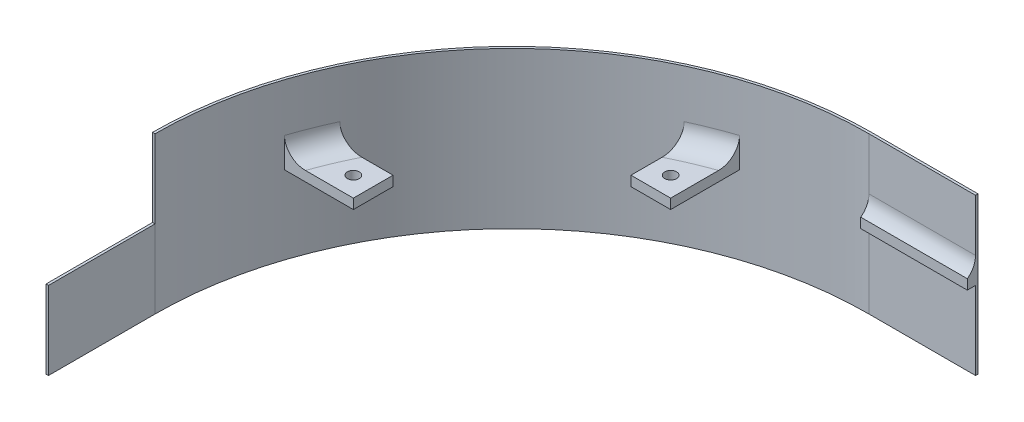
from build123d import *
from build123d.topology import SkipClean

# Parameters (mm, degrees)
BOSS_EXTRUDE1_DEPTH      = 6.35
CUT_EXTRUDE1_DEPTH       = 6.35
M4_CLEARANCE_HOLE1_D     = 4.5
F_6_CLEARANCE_HOLE1_D    = 3.7973
F_6_CLEARANCE_HOLE2_D    = 3.7973
SKETCH29_R               = 1.898650000000008
BOSS_EXTRUDE4_DEPTH      = 3.175
CUT_EXTRUDE9_DEPTH       = 211.00951038732748
BOSS_EXTRUDE5_DEPTH      = 25
BOSS_EXTRUDE5_DEPTH_BACK = 25
BOSS_EXTRUDE6_DEPTH      = 3.420518063
SKETCH32_W               = 34.13124999999999
SKETCH32_H               = 3.175
BOSS_EXTRUDE7_DEPTH      = 3.420518063
FILLET2_R                = 6.35
FILLET3_R                = 6.35
SKETCH33_W               = 62.65129797244943
SKETCH33_H               = 51.38023684891144
CUT_EXTRUDE10_DEPTH      = 211.97362412866636


with BuildPart() as part:
    # Sketch1 → Boss-Extrude1 (new body)
    with BuildSketch(Plane(origin=(0, 0, 0), x_dir=(1, 0, 0), z_dir=(0, 1, 0))):
        with BuildLine():
            Line((-34.13124999999996, -148.43124999999998), (34.131250000000016, -148.43124999999998))
            ThreePointArc((34.131250000000016, -148.43124999999998), (114.9535550896224, -114.95355508962234), (148.43124999999998, -34.13124999999996))
            Line((148.43124999999998, -34.13124999999996), (148.43124999999998, 34.131250000000016))
            ThreePointArc((148.43124999999998, 34.131250000000016), (114.9535550896224, 114.9535550896224), (34.131250000000016, 148.43125000000003))
            Line((34.131250000000016, 148.43125000000003), (-34.13124999999996, 148.43125000000003))
            ThreePointArc((-34.13124999999996, 148.43125000000003), (-114.95355508962231, 114.95355508962237), (-148.43124999999992, 34.131250000000016))
            Line((-148.43124999999992, 34.131250000000016), (-148.43124999999992, -34.13124999999996))
            ThreePointArc((-148.43124999999992, -34.13124999999996), (-114.95355508962234, -114.95355508962234), (-34.13124999999996, -148.43124999999998))
        make_face()
    extrude(amount=BOSS_EXTRUDE1_DEPTH)

    # Sketch4 → Cut-Extrude1 (cut)
    # profile 1 of 4: a face of its own
    with BuildSketch(Plane(origin=(0, 6.35, 0), x_dir=(1, 0, 0), z_dir=(0, 1, 0))):
        with BuildLine():
            ThreePointArc((-39.4480000000008, 145.80448193711538), (-49.893930566331434, 144.3300216659586), (-59.52363351317686, 140.0218527227403))
            ThreePointArc((-59.52363351317686, 140.0218527227403), (-63.81750000000949, 132.2535819370977), (-59.52363351317676, 124.48531115145514))
            ThreePointArc((-59.52363351317676, 124.48531115145514), (-49.89393056632884, 120.17714220824536), (-39.448000000000604, 118.70268193708908))
            Line((-39.448000000000604, 118.70268193708908), (39.44799999999939, 118.70268193708088))
            ThreePointArc((39.44799999999939, 118.70268193708088), (49.89393056633003, 120.17714220823765), (59.52363351317546, 124.48531115145597))
            ThreePointArc((59.52363351317546, 124.48531115145597), (63.817500000008096, 132.25358193709857), (59.523633513170694, 140.0218527227337))
            ThreePointArc((59.523633513170694, 140.0218527227337), (49.893930566325004, 144.3300216659425), (39.4479999999992, 145.80448193710717))
            Line((39.4479999999992, 145.80448193710717), (-39.4480000000008, 145.80448193711538))
        make_face()
        with BuildLine():
            ThreePointArc((39.447999999999375, 120.29018193708089), (49.454528647108134, 121.70261990502122), (58.67916380898574, 125.82956825808905))
            ThreePointArc((58.67916380898574, 125.82956825808905), (62.229999999999336, 132.25358193709857), (58.67916380898565, 138.67759561610805))
            ThreePointArc((58.67916380898565, 138.67759561610805), (49.45452864710313, 142.80454396915894), (39.447999999999205, 144.21698193711595))
            Line((39.447999999999205, 144.21698193711595), (-39.44800000000079, 144.21698193711538))
            ThreePointArc((-39.44800000000079, 144.21698193711538), (-49.454528647109534, 142.80454396917506), (-58.67916380898715, 138.67759561610723))
            ThreePointArc((-58.67916380898715, 138.67759561610723), (-62.23000000000073, 132.25358193709772), (-58.67916380898706, 125.82956825808822))
            ThreePointArc((-58.67916380898706, 125.82956825808822), (-49.454528647104546, 121.70261990503734), (-39.44800000000062, 120.29018193708033))
            Line((-39.44800000000062, 120.29018193708033), (39.447999999999375, 120.29018193708089))
        make_face(mode=Mode.SUBTRACT)
    # profile 2 of 4: a face of its own
    with BuildSketch(Plane(origin=(0, 6.35, 0), x_dir=(1, 0, 0), z_dir=(0, 1, 0))):
        with BuildLine():
            Line((-39.44800000000062, 120.29018193708033), (39.447999999999375, 120.29018193708089))
            ThreePointArc((39.447999999999375, 120.29018193708089), (49.454528647108134, 121.70261990502122), (58.67916380898574, 125.82956825808905))
            ThreePointArc((58.67916380898574, 125.82956825808905), (62.229999999999336, 132.25358193709857), (58.67916380898565, 138.67759561610805))
            ThreePointArc((58.67916380898565, 138.67759561610805), (49.45452864710313, 142.80454396915894), (39.447999999999205, 144.21698193711595))
            Line((39.447999999999205, 144.21698193711595), (-39.44800000000079, 144.21698193711538))
            ThreePointArc((-39.44800000000079, 144.21698193711538), (-49.454528647109534, 142.80454396917506), (-58.67916380898715, 138.67759561610723))
            ThreePointArc((-58.67916380898715, 138.67759561610723), (-62.23000000000073, 132.25358193709772), (-58.67916380898706, 125.82956825808822))
            ThreePointArc((-58.67916380898706, 125.82956825808822), (-49.454528647104546, 121.70261990503734), (-39.44800000000062, 120.29018193708033))
        make_face()
    # profile 3 of 4: a face of its own
    with BuildSketch(Plane(origin=(0, 6.35, 0), x_dir=(1, 0, 0), z_dir=(0, 1, 0))):
        with BuildLine():
            ThreePointArc((-59.5236335131764, -124.48531115145636), (-63.8175000000091, -132.25358193709894), (-59.52363351317174, -140.02185272273414))
            ThreePointArc((-59.52363351317174, -140.02185272273414), (-49.893930566326084, -144.33002166594298), (-39.44800000000029, -145.80448193711646))
            Line((-39.44800000000029, -145.80448193711646), (39.44799999999971, -145.80448193711646))
            ThreePointArc((39.44799999999971, -145.80448193711646), (49.89393056633035, -144.33002166595978), (59.52363351317579, -140.02185272274153))
            ThreePointArc((59.52363351317579, -140.02185272274153), (63.8175000000085, -132.25358193709894), (59.52363351317116, -124.48531115146376))
            ThreePointArc((59.52363351317116, -124.48531115146376), (49.89393056632551, -120.1771422082549), (39.44799999999971, -118.70268193709018))
            Line((39.44799999999971, -118.70268193709018), (-39.44800000000029, -118.70268193708142))
            ThreePointArc((-39.44800000000029, -118.70268193708142), (-49.89393056633094, -120.17714220823811), (-59.5236335131764, -124.48531115145636))
        make_face()
        with BuildLine():
            ThreePointArc((-58.679163808986694, -138.67759561610845), (-49.454528647104205, -142.8045439691594), (-39.44800000000029, -144.21698193711646))
            Line((-39.44800000000029, -144.21698193711646), (39.44799999999971, -144.21698193711646))
            ThreePointArc((39.44799999999971, -144.21698193711646), (49.45452864710846, -142.8045439691762), (58.679163808986104, -138.67759561610845))
            ThreePointArc((58.679163808986104, -138.67759561610845), (62.22999999999976, -132.25358193709894), (58.679163808986104, -125.82956825808944))
            ThreePointArc((58.679163808986104, -125.82956825808944), (49.45452864710362, -121.7026199050385), (39.44799999999971, -120.29018193708143))
            Line((39.44799999999971, -120.29018193708143), (-39.44800000000029, -120.29018193708143))
            ThreePointArc((-39.44800000000029, -120.29018193708143), (-49.45452864710904, -121.70261990502169), (-58.679163808986694, -125.82956825808944))
            ThreePointArc((-58.679163808986694, -125.82956825808944), (-62.230000000000345, -132.25358193709894), (-58.679163808986694, -138.67759561610845))
        make_face(mode=Mode.SUBTRACT)
    # profile 4 of 4: a face of its own
    with BuildSketch(Plane(origin=(0, 6.35, 0), x_dir=(1, 0, 0), z_dir=(0, 1, 0))):
        with BuildLine():
            ThreePointArc((-58.679163808986694, -125.82956825808944), (-62.230000000000345, -132.25358193709894), (-58.679163808986694, -138.67759561610845))
            ThreePointArc((-58.679163808986694, -138.67759561610845), (-49.454528647104205, -142.8045439691594), (-39.44800000000029, -144.21698193711646))
            Line((-39.44800000000029, -144.21698193711646), (39.44799999999971, -144.21698193711646))
            ThreePointArc((39.44799999999971, -144.21698193711646), (49.45452864710846, -142.8045439691762), (58.679163808986104, -138.67759561610845))
            ThreePointArc((58.679163808986104, -138.67759561610845), (62.22999999999976, -132.25358193709894), (58.679163808986104, -125.82956825808944))
            ThreePointArc((58.679163808986104, -125.82956825808944), (49.45452864710362, -121.7026199050385), (39.44799999999971, -120.29018193708143))
            Line((39.44799999999971, -120.29018193708143), (-39.44800000000029, -120.29018193708143))
            ThreePointArc((-39.44800000000029, -120.29018193708143), (-49.45452864710904, -121.70261990502169), (-58.679163808986694, -125.82956825808944))
        make_face()
    extrude(amount=-CUT_EXTRUDE1_DEPTH, mode=Mode.SUBTRACT)

    # M4 Clearance Hole1 (through all)
    with Locations(Plane(origin=(0, 6.35, 0), x_dir=(1, 0, 0), z_dir=(0, 1, 0))):
        with Locations((-16, -103.6875), (16, -103.6875), (22, -60.325), (-10, -60.325), (-10, 60.325), (22, 60.325), (16, 103.6875), (-16, 103.6875)):
            Hole(M4_CLEARANCE_HOLE1_D / 2)

    # #6 Clearance Hole1 (through all)
    with Locations(Plane(origin=(0, 6.35, 0), x_dir=(1, 0, 0), z_dir=(0, 1, 0))):
        with Locations((-101.6, -101.6), (-101.6, 101.6), (101.6, 101.6), (101.6, -101.6), (-127, -76.2), (-127, -50.8), (-127, 50.8), (-127, 76.2), (-101.6, 76.2), (-101.6, 50.8), (-101.6, 25.4), (-101.6, 0), (-101.6, -25.4), (-101.6, -50.8), (-101.6, -76.2), (-76.2, -101.6), (-50.8, -101.6), (-50.8, -76.2), (-76.2, -76.2), (-76.2, -50.8), (-50.8, -50.8), (-50.8, -25.4), (-76.2, -25.4), (-76.2, 0), (-50.8, 0), (-50.8, 25.4), (-76.2, 25.4), (-76.2, 50.8), (-50.8, 50.8), (-50.8, 76.2), (-76.2, 76.2), (-76.2, 101.6), (-50.8, 101.6), (50.8, -101.6), (76.2, -101.6), (101.6, -76.2), (127, -76.2), (127, -50.8), (101.6, -25.4), (101.6, -50.8), (76.2, -25.4), (76.2, -50.8), (76.2, -76.2), (50.8, -76.2), (50.8, -50.8), (50.8, -25.4), (50.8, 0), (76.2, 0), (101.6, 0), (101.6, 25.4), (101.6, 50.8), (101.6, 76.2), (127, 50.8), (127, 76.2), (76.2, 101.6), (50.8, 101.6), (50.8, 76.2), (76.2, 76.2), (76.2, 50.8), (76.2, 25.4), (50.8, 25.4), (50.8, 50.8), (0, 0), (-25.4, -25.4), (-25.4, 0), (-25.4, 25.4), (0, 25.4), (25.4, 25.4), (25.4, 0), (25.4, -25.4), (0, -25.4), (127, -25.4), (127, 0), (127, 25.4), (-127, -25.4), (-127, 0), (-127, 25.4)):
            Hole(F_6_CLEARANCE_HOLE1_D / 2)

    # #6 Clearance Hole2 (through all)
    with Locations(Plane(origin=(0, 6.35, 0), x_dir=(1, 0, 0), z_dir=(0, 1, 0))):
        with Locations((-76.2, -127), (76.2, -127), (76.2, 127), (-76.2, 127)):
            Hole(F_6_CLEARANCE_HOLE2_D / 2)

    # Sketch29 → Boss-Extrude4 (add)
    # profile 1 of 4: a face of its own
    with BuildSketch(Plane(origin=(0, 6.35, 0), x_dir=(1, 0, 0), z_dir=(0, 1, 0))):
        with BuildLine():
            Line((-69.85, 120.64999999999999), (-69.85, 142.70684992207043))
            ThreePointArc((-69.85, 142.70684992207043), (-76.27533753088031, 140.3779717667891), (-82.55, 137.66923649982286))
            Line((-82.55, 137.6692364998229), (-82.54999999999998, 120.64999999999999))
            Line((-82.54999999999998, 120.64999999999999), (-69.85, 120.64999999999999))
        make_face()
        with Locations(Location((-76.19999999999999, 127, 0), (0, 0, 270))):
            Circle(SKETCH29_R, mode=Mode.SUBTRACT)
    # profile 2 of 4: a face of its own
    with BuildSketch(Plane(origin=(0, 6.35, 0), x_dir=(1, 0, 0), z_dir=(0, 1, 0))):
        with BuildLine():
            Line((-120.6500000000006, 82.54999999999993), (-137.6692364998229, 82.54999999999993))
            ThreePointArc((-137.66923649982286, 82.5499999999999), (-140.37797176678907, 76.27533753088025), (-142.70684992207038, 69.84999999999994))
            Line((-142.70684992207043, 69.84999999999994), (-120.6500000000006, 69.84999999999994))
            Line((-120.6500000000006, 69.84999999999994), (-120.6500000000006, 82.54999999999993))
        make_face()
        with Locations(Location((-127.00000000000061, 76.19999999999993, 0), (0, 0, 270))):
            Circle(SKETCH29_R, mode=Mode.SUBTRACT)
    # profile 3 of 4: a face of its own
    with BuildSketch(Plane(origin=(0, 6.35, 0), x_dir=(1, 0, 0), z_dir=(0, 1, 0))):
        Polygon((-145.8044819371153, 34.13124999999998), (-145.8044819371153, 0), (-148.43124999999995, 2.082e-14), (-148.43124999999995, 34.131249999999994), align=None)
    # profile 4 of 4: a face of its own
    with BuildSketch(Plane(origin=(0, 6.35, 0), x_dir=(1, 0, 0), z_dir=(0, 1, 0))):
        Polygon((2.776e-14, 148.43125), (0, 145.80448193711538), (-34.13124999999999, 145.80448193711538), (-34.13124999999996, 148.43125000000003), align=None)
    extrude(amount=BOSS_EXTRUDE4_DEPTH)

    # Sketch30 → Cut-Extrude9 (cut, through all)
    with BuildSketch(Plane(origin=(0, 6.35, 0), x_dir=(1, 0, 0), z_dir=(0, 1, 0))):
        with BuildLine():
            Line((-34.13124999999998, -148.43124999999995), (34.131250000000016, -148.43124999999998))
            ThreePointArc((34.131250000000016, -148.43124999999998), (114.9535550896224, -114.95355508962234), (148.43125, -34.13124999999996))
            Line((148.43125, -34.13124999999996), (148.43124999999998, 34.131250000000016))
            ThreePointArc((148.43124999999998, 34.131250000000016), (114.95355508962237, 114.95355508962237), (34.13125000000002, 148.43125))
            Line((34.13125000000002, 148.43125), (-34.13124999999996, 148.43125000000003))
            ThreePointArc((-34.13124999999996, 148.43125000000003), (-114.95355508962234, 114.9535550896224), (-148.43124999999995, 34.13125000000003))
            Line((-148.43124999999995, 34.13125000000003), (-148.43124999999995, -34.131249999999945))
            ThreePointArc((-148.43124999999995, -34.131249999999945), (-114.95355508962234, -114.95355508962231), (-34.13124999999998, -148.43124999999995))
        make_face()
    extrude(amount=-CUT_EXTRUDE9_DEPTH, mode=Mode.SUBTRACT)


with BuildPart() as cut_extrude9_piece_1:
    # of the separate pieces the step leaves, piece 1, a body of its own (cut_extrude9_pieces)
    add(part.part.solids().sort_by_distance((-82.55, 6.35, -137.6692365))[0])



with BuildPart() as cut_extrude9_piece_2:
    # of the separate pieces the step leaves, piece 2, a body of its own (cut_extrude9_pieces)
    add(part.part.solids().sort_by_distance((-142.706849922, 6.35, -69.85))[0])


with BuildPart() as cut_extrude9_piece_3:
    # of the separate pieces the step leaves, piece 3, a body of its own (cut_extrude9_pieces)
    add(part.part.solids().sort_by_distance((-148.43125, 6.35, -34.13125))[0])


with BuildPart() as cut_extrude9_piece_4:
    # of the separate pieces the step leaves, piece 4, a body of its own (cut_extrude9_pieces)
    add(part.part.solids().sort_by_distance((-34.13125, 6.35, -145.804481937))[0])


with BuildPart() as cut_extrude9_piece_1_1:
    add(cut_extrude9_piece_1.part)

    add(cut_extrude9_piece_2.part)  # Boss-Extrude5 merges Cut-Extrude9 piece 2
    # Sketch29<7> → Boss-Extrude5 (add, two sides: drawn at the far end of the back side and taken through both)
    with BuildSketch(Plane(origin=(0, 6.35, 0), x_dir=(1, 0, 0), z_dir=(0, 1, 0)).offset(-BOSS_EXTRUDE5_DEPTH_BACK)):
        with BuildLine():
            ThreePointArc((-69.85, 142.70684992207043), (-52.21852354947877, 146.99107693388436), (-34.13124999999996, 148.43125000000003))
            Line((-34.13124999999996, 148.43125000000003), (2.842e-14, 148.43125))
            Line((2.776e-14, 148.43125), (2.776e-14, 149.22500000000002))
            Line((2.776e-14, 149.22500000000002), (-34.13124999999996, 149.22500000000002))
            ThreePointArc((-34.13124999999995, 149.22500000000002), (-115.51482109718914, 115.51482109718923), (-149.22499999999997, 34.13125000000003))
            Line((-149.22499999999997, 34.131249999999994), (-149.22499999999997, 2.132e-14))
            Line((-149.22499999999997, 2.082e-14), (-148.43124999999995, 2.082e-14))
            Line((-148.43124999999995, 2.132e-14), (-148.43124999999995, 34.131249999999994))
            ThreePointArc((-148.43124999999995, 34.13125000000001), (-146.9910769338843, 52.218523549478746), (-142.70684992207038, 69.84999999999994))
            ThreePointArc((-142.70684992207038, 69.84999999999994), (-140.37797176678907, 76.27533753088025), (-137.66923649982286, 82.5499999999999))
            ThreePointArc((-137.6692364998229, 82.54999999999994), (-114.9535550896224, 114.95355508962237), (-82.55000000000001, 137.66923649982292))
            ThreePointArc((-82.55, 137.66923649982286), (-76.27533753088031, 140.3779717667891), (-69.85, 142.70684992207043))
        make_face()
    extrude(amount=BOSS_EXTRUDE5_DEPTH + BOSS_EXTRUDE5_DEPTH_BACK)


    add(cut_extrude9_piece_3.part)  # Boss-Extrude6 merges Cut-Extrude9 piece 3
    # Sketch31 → Boss-Extrude6 (add)
    with BuildSketch(Plane(origin=(-145.8044819371153, 0, 0), x_dir=(0, 0, -1), z_dir=(1, 0, 0))):
        Polygon((1.15561e-12, 6.35), (34.13124999999998, 6.35), (34.13124999999998, 9.524999999999999), (1.15548e-12, 9.524999999999999), align=None)
    extrude(amount=-BOSS_EXTRUDE6_DEPTH)


    add(cut_extrude9_piece_4.part)  # Boss-Extrude7 merges Cut-Extrude9 piece 4
    # Sketch32 → Boss-Extrude7 (add)
    with BuildSketch(Plane.XY.offset(-145.80448193711126)):
        with Locations((-17.065625000015128, 7.937499999999998)):
            Rectangle(SKETCH32_W, SKETCH32_H)
    extrude(amount=-BOSS_EXTRUDE7_DEPTH)

    # Fillet2
    fillet2_edges = [cut_extrude9_piece_1_1.edges().sort_by_distance(p)[0] for p in [
        (-76.27533753088031, 9.524999999999999, -140.3779717667891),
        (-140.37797176678907, 9.524999999999999, -76.27533753088022),
    ]]
    fillet(fillet2_edges, radius=FILLET2_R)

    # Fillet3
    # the kernel refuses this fillet: 6.35 mm, written as the material it adds along each edge
    with BuildSketch(Plane(origin=(-34.13124999999996, 9.524999999999999, -148.43125000000003), x_dir=(0, 1, 0), z_dir=(1, 0, 8.3e-16))) as fillet3_piece_1:
        with BuildLine():
            CenterArc((5.143932731135228, 6.349999999999994), FILLET3_R, 215.89740993891724, 54.102590061082765)
            Line((0, 2.6267680628846506), (-0.10287865462270496, 2.5523034241423375))
            ThreePointArc((-0.10287865462270496, 2.5523034241423375), (-0.12700000000000067, 1.3133840314423253), (-0.12700000000000067, 0))
            Line((-0.12700000000000067, 0), (0, -0.12700000000000955))
            Line((0, -0.12700000000000955), (5.143932731135228, -0.12700000000000955))
            Line((5.143932731135228, -0.12700000000000955), (5.143932731135228, 0))
        make_face()
    extrude(amount=34.13124999999999)
    with BuildSketch(Plane(origin=(-148.43124999999995, 9.524999999999999, -2.082e-14), x_dir=(0, 1, 0), z_dir=(0, 0, -1))) as fillet3_piece_2:
        with BuildLine():
            CenterArc((5.143932731135228, 6.349999999999994), FILLET3_R, 215.89740993891724, 54.102590061082765)
            Line((0, 2.6267680628846506), (-0.10287865462270496, 2.5523034241423375))
            ThreePointArc((-0.10287865462270496, 2.5523034241423375), (-0.12700000000000067, 1.3133840314423253), (-0.12700000000000067, 0))
            Line((-0.12700000000000067, 0), (0, -0.12700000000000955))
            Line((0, -0.12700000000000955), (5.143932731135228, -0.12700000000000955))
            Line((5.143932731135228, -0.12700000000000955), (5.143932731135228, 0))
        make_face()
    extrude(amount=34.13124999999997)

    # Sketch33 → Cut-Extrude10 (cut, through all)
    with SkipClean():  # the faces are left unmerged after this step: merging them gives an invalid solid
        with BuildSketch(Plane(origin=(-145.8044819371153, 0, 0), x_dir=(0, 0, -1), z_dir=(1, 0, 0))):
            with Locations((2.8056010137752665, 32.04011842445572)):
                Rectangle(SKETCH33_W, SKETCH33_H)
        extrude(amount=-CUT_EXTRUDE10_DEPTH, mode=Mode.SUBTRACT)


solid = cut_extrude9_piece_1_1.part
